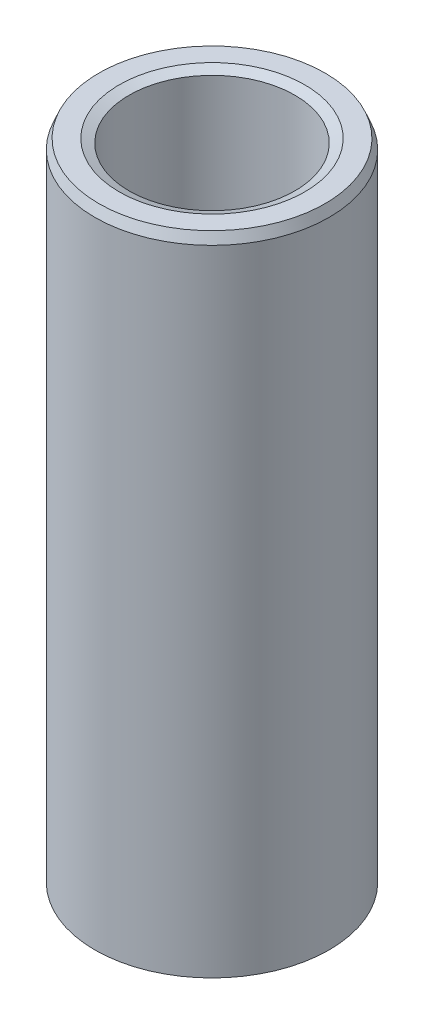
from build123d import *
from OCP.BRepFilletAPI import BRepFilletAPI_MakeChamfer

# Parameters (mm, degrees)
SKETCH1_R           = 32.5
BOSS_EXTRUDE1_DEPTH = 179.811402842
SKETCH2_R           = 23.001645592
CUT_EXTRUDE1_DEPTH  = 186.592673864
CHAMFER1_SIZE       = 2.732422853
CHAMFER1_SIZE2      = 1.126626536


with BuildPart() as part:
    # Sketch1 → Boss-Extrude1 (new body)
    with BuildSketch(Plane(origin=(0, 0, 0), x_dir=(1, 0, 0), z_dir=(0, 1, 0))):
        Circle(SKETCH1_R)
    extrude(amount=BOSS_EXTRUDE1_DEPTH)

    # Sketch2 → Cut-Extrude1 (cut, through all)
    with BuildSketch(Plane(origin=(0, 0, 0), x_dir=(1, 0, 0), z_dir=(0, 1, 0))):
        Circle(SKETCH2_R)
    extrude(amount=CUT_EXTRUDE1_DEPTH, mode=Mode.SUBTRACT)

    # Chamfer1: one chamfer whose edges measure the first distance from different faces: ONE call of the kernel's chamfer builder (chamfer() names one face for all edges)
    chamfer1_edges_1 = [part.edges().sort_by_distance(p)[0] for p in [
        (-23.001645592, 179.811402842, 0),
    ]]
    chamfer1_side_1 = [part.faces().sort_by_distance(p)[0] for p in [
        (-31.580761184, 179.811402842, 0),
    ]]
    chamfer1_edges_2 = [part.edges().sort_by_distance(p)[0] for p in [
        (-23.001645592, 0, 0),
    ]]
    chamfer1_side_2 = [part.faces().sort_by_distance(p)[0] for p in [
        (-23.001645592, 89.905701421, 0),
    ]]
    chamfer1_edges_3 = [part.edges().sort_by_distance(p)[0] for p in [
        (-32.5, 0, 0),
    ]]
    chamfer1_side_3 = [part.faces().sort_by_distance(p)[0] for p in [
        (-31.580761184, 0, 0),
    ]]
    chamfer1_edges_4 = [part.edges().sort_by_distance(p)[0] for p in [
        (-32.5, 179.811402842, 0),
    ]]
    chamfer1_side_4 = [part.faces().sort_by_distance(p)[0] for p in [
        (-32.5, 89.905701421, 0),
    ]]
    chamfer1 = BRepFilletAPI_MakeChamfer(part.part.solid().wrapped)
    for e in chamfer1_edges_1:
        chamfer1.Add(CHAMFER1_SIZE, CHAMFER1_SIZE2, e.wrapped, chamfer1_side_1[0].wrapped)  # the first distance lies on this face
    for e in chamfer1_edges_2:
        chamfer1.Add(CHAMFER1_SIZE, CHAMFER1_SIZE2, e.wrapped, chamfer1_side_2[0].wrapped)  # the first distance lies on this face
    for e in chamfer1_edges_3:
        chamfer1.Add(CHAMFER1_SIZE, CHAMFER1_SIZE2, e.wrapped, chamfer1_side_3[0].wrapped)  # the first distance lies on this face
    for e in chamfer1_edges_4:
        chamfer1.Add(CHAMFER1_SIZE, CHAMFER1_SIZE2, e.wrapped, chamfer1_side_4[0].wrapped)  # the first distance lies on this face
    add(Compound.cast(chamfer1.Shape()), mode=Mode.REPLACE)


solid = part.part
